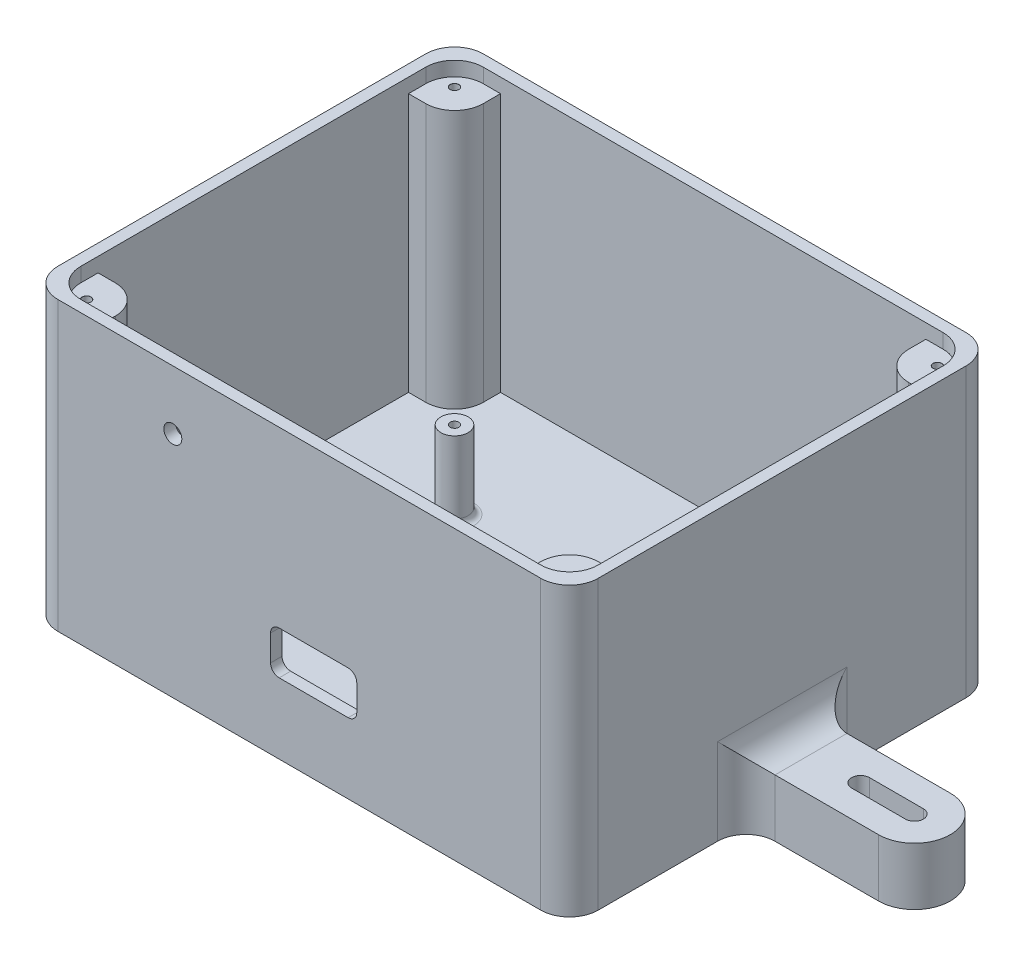
from build123d import *

# Parameters (mm, degrees)
ESBO_O1_W                                  = 4.75
ESBO_O1_H                                  = 1
REVOLU_O1_ANGLE                            = 180
ESBO_O2_W                                  = 9.5
ESBO_O2_H                                  = 74
RESSALTO_EXTRUS_O1_DEPTH                   = 8.75
ESBO_O3_W                                  = 8.75
ESBO_O3_H                                  = 73
CORTE_EXTRUS_O1_DEPTH                      = 1.5
ESBO_O4_W                                  = 8
ESBO_O4_H                                  = 73
CORTE_EXTRUS_O2_DEPTH                      = 4.75
ESBO_O5_W                                  = 4
ESBO_O5_H                                  = 68
RESSALTO_EXTRUS_O2_DEPTH                   = 52
ESBO_O6_W                                  = 4
ESBO_O6_H                                  = 74
RESSALTO_EXTRUS_O3_DEPTH                   = 80
ESBO_O7_W                                  = 4
ESBO_O7_H                                  = 74
RESSALTO_EXTRUS_O4_DEPTH                   = 40
ESBO_O8_W                                  = 144
ESBO_O8_H                                  = 74
RESSALTO_EXTRUS_O5_DEPTH                   = 4
ESBO_O9_W                                  = 144
ESBO_O9_H                                  = 74
RESSALTO_EXTRUS_O6_DEPTH                   = 4
ESBO_O10_W                                 = 188
ESBO_O10_H                                 = 74
RESSALTO_EXTRUS_O7_DEPTH                   = 4
ESBO_O11_W                                 = 188
ESBO_O11_H                                 = 148
RESSALTO_EXTRUS_O8_DEPTH                   = 26
CORTE_EXTRUS_O3_DEPTH                      = 21
RESSALTO_EXTRUS_O9_DEPTH                   = 20
CORTE_EXTRUS_O4_DEPTH                      = 268.847437919
RESSALTO_EXTRUS_O10_DEPTH                  = 20
CORTE_EXTRUS_O5_DEPTH                      = 262.040705638
ESBO_O17_W                                 = 16
ESBO_O17_H                                 = 16
RESSALTO_EXTRUS_O11_DEPTH                  = 90
ESBO_O18_W                                 = 16
ESBO_O18_H                                 = 16
RESSALTO_EXTRUS_O12_DEPTH                  = 90
ESBO_O19_W                                 = 16
ESBO_O19_H                                 = 16
RESSALTO_EXTRUS_O13_DEPTH                  = 90
ESBO_O20_W                                 = 16
ESBO_O20_H                                 = 16
RESSALTO_EXTRUS_O14_DEPTH                  = 90
RESSALTO_EXTRUS_O15_DEPTH                  = 22
ESBO_O22_W                                 = 4.75
ESBO_O22_H                                 = 22
FURO_DE_DI_METRO_3_0_3_1_D                 = 3
FURO_DE_DI_METRO_3_0_3_1_DEPTH             = 15
FURO_DE_DI_METRO_3_0_3_1_TIP               = 0.901290929
FURO_DE_DI_METRO_3_0_3_2_D                 = 3
FURO_DE_DI_METRO_3_0_3_2_DEPTH             = 15
FURO_DE_DI_METRO_3_0_3_2_TIP               = 0.901290929
BROCA_DE_ROSQUEAR_PARA_HELICOIDE_M61_D     = 6.25
BROCA_DE_ROSQUEAR_PARA_HELICOIDE_M61_DEPTH = 4
CHANFRO1_SIZE                              = 0.025
FILETE1_R                                  = 2
FILETE2_R                                  = 10
ESBO_O35_W                                 = 4.75
ESBO_O35_H                                 = 22
FILETE3_R                                  = 2
ESBO_O43_W                                 = 52
ESBO_O43_H                                 = 6
RESSALTO_EXTRUS_O16_DEPTH                  = 4
ESBO_O44_R                                 = 4.75
ESBO_O44_R_2                               = 1.525
RESSALTO_EXTRUS_O17_DEPTH                  = 5
CORTE_EXTRUS_O7_DEPTH                      = 10


with BuildPart() as part:
    # Esboço1 → Revolução1 (revolve)
    with BuildSketch(Plane.XY.offset(-4.75)):
        with Locations((97.625, 26.5)):
            Rectangle(ESBO_O1_W, ESBO_O1_H)
    revolve(axis=Axis((95.25, 27, -4.75), (0, 1, 0)), revolution_arc=REVOLU_O1_ANGLE)

    # Esboço2 → Ressalto-extrusão1 (add)
    with BuildSketch(Plane.XY.offset(-4.75)):
        with Locations((95.25, 63)):
            Rectangle(ESBO_O2_W, ESBO_O2_H)
    extrude(amount=RESSALTO_EXTRUS_O1_DEPTH)

    # Esboço3 → Corte-extrusão1 (cut)
    with BuildSketch(Plane.ZY.offset(-90.5)):
        with Locations((-0.375, 63.5)):
            Rectangle(ESBO_O3_W, ESBO_O3_H)
    extrude(amount=-CORTE_EXTRUS_O1_DEPTH, mode=Mode.SUBTRACT)

    # Esboço4 → Corte-extrusão2 (cut)
    with BuildSketch(Plane(origin=(0, 0, -4.75), x_dir=(-1, 0, 0), z_dir=(0, 0, -1))):
        with Locations((-96, 63.5)):
            Rectangle(ESBO_O4_W, ESBO_O4_H)
    extrude(amount=-CORTE_EXTRUS_O2_DEPTH, mode=Mode.SUBTRACT)

    # Esboço5 → Ressalto-extrusão2 (add)
    with BuildSketch(Plane.ZY.offset(-92)):
        with Locations((2, 66)):
            Rectangle(ESBO_O5_W, ESBO_O5_H)
    extrude(amount=RESSALTO_EXTRUS_O2_DEPTH)

    # Esboço6 → Ressalto-extrusão3 (add)
    with BuildSketch(Plane.ZY.offset(-40)):
        with Locations((2, 63)):
            Rectangle(ESBO_O6_W, ESBO_O6_H)
    extrude(amount=RESSALTO_EXTRUS_O3_DEPTH)

    # Esboço7 → Ressalto-extrusão4 (add)
    with BuildSketch(Plane(origin=(100, 0, 0), x_dir=(0, 0, -1), z_dir=(1, 0, 0))):
        with Locations((-2, 63)):
            Rectangle(ESBO_O7_W, ESBO_O7_H)
    extrude(amount=RESSALTO_EXTRUS_O4_DEPTH)

    # Esboço8 → Ressalto-extrusão5 (add)
    with BuildSketch(Plane(origin=(140, 0, 0), x_dir=(0, 0, -1), z_dir=(1, 0, 0))):
        with Locations((68, 63)):
            Rectangle(ESBO_O8_W, ESBO_O8_H)
    extrude(amount=RESSALTO_EXTRUS_O5_DEPTH)

    # Esboço9 → Ressalto-extrusão6 (add)
    with BuildSketch(Plane.ZY.offset(40)):
        with Locations((-68, 63)):
            Rectangle(ESBO_O9_W, ESBO_O9_H)
    extrude(amount=RESSALTO_EXTRUS_O6_DEPTH)

    # Esboço10 → Ressalto-extrusão7 (add)
    with BuildSketch(Plane(origin=(0, 0, -140), x_dir=(-1, 0, 0), z_dir=(0, 0, -1))):
        with Locations((-50, 63)):
            Rectangle(ESBO_O10_W, ESBO_O10_H)
    extrude(amount=RESSALTO_EXTRUS_O7_DEPTH)

    # Esboço11 → Ressalto-extrusão8 (add)
    with BuildSketch(Plane.XZ.offset(-26)):
        with Locations((50, -70)):
            Rectangle(ESBO_O11_W, ESBO_O11_H)
    extrude(amount=RESSALTO_EXTRUS_O8_DEPTH)

    # Esboço12 → Corte-extrusão3 (cut)
    with BuildSketch(Plane(origin=(0, 26, 0), x_dir=(-1, 0, 0), z_dir=(0, 1, 0))):
        with BuildLine():
            Line((-140, -140), (40, -140))
            Line((40, -140), (40, 0))
            Line((40, 0), (-90.5, 0))
            Line((-90.5, 0), (-90.5, -4.75))
            ThreePointArc((-90.5, -4.75), (-95.25, -9.5), (-100, -4.75))
            Line((-100, -4.75), (-100, 0))
            Line((-100, 0), (-140, 0))
            Line((-140, 0), (-140, -140))
        make_face()
    extrude(amount=-CORTE_EXTRUS_O3_DEPTH, mode=Mode.SUBTRACT)

    # Esboço13 → Ressalto-extrusão9 (add)
    with BuildSketch(Plane.XZ):
        with BuildLine():
            Line((144, -82.5), (190, -82.5))
            ThreePointArc((190, -82.5), (202.5, -70), (190, -57.5))
            Line((190, -57.5), (144, -57.5))
            Line((144, -57.5), (144, -82.5))
        make_face()
    extrude(amount=-RESSALTO_EXTRUS_O9_DEPTH)

    # Esboço14 → Corte-extrusão4 (cut, through all)
    with BuildSketch(Plane.XZ):
        with BuildLine():
            Line((190, -66.875), (171.25, -66.875))
            ThreePointArc((171.25, -66.875), (168.125, -70), (171.25, -73.125))
            Line((171.25, -73.125), (190, -73.125))
            ThreePointArc((190, -73.125), (193.125, -70), (190, -66.875))
        make_face()
    extrude(amount=-CORTE_EXTRUS_O4_DEPTH, mode=Mode.SUBTRACT)

    # Esboço15 → Ressalto-extrusão10 (add)
    with BuildSketch(Plane.XZ):
        with BuildLine():
            Line((-44, -57.5), (-90, -57.5))
            ThreePointArc((-90, -57.5), (-102.5, -70), (-90, -82.5))
            Line((-90, -82.5), (-44, -82.5))
            Line((-44, -82.5), (-44, -57.5))
        make_face()
    extrude(amount=-RESSALTO_EXTRUS_O10_DEPTH)

    # Esboço16 → Corte-extrusão5 (cut, through all)
    with BuildSketch(Plane(origin=(0, 20, 0), x_dir=(-1, 0, 0), z_dir=(0, 1, 0))):
        with BuildLine():
            Line((71.25, -73.125), (90, -73.125))
            ThreePointArc((90, -73.125), (93.125, -70), (90, -66.875))
            Line((90, -66.875), (71.25, -66.875))
            ThreePointArc((71.25, -66.875), (68.125, -70), (71.25, -73.125))
        make_face()
    extrude(amount=-CORTE_EXTRUS_O5_DEPTH, mode=Mode.SUBTRACT)

    # Esboço17 → Ressalto-extrusão11 (add)
    with BuildSketch(Plane(origin=(0, 5, 0), x_dir=(-1, 0, 0), z_dir=(0, 1, 0))):
        with Locations((32, -132)):
            Rectangle(ESBO_O17_W, ESBO_O17_H)
    extrude(amount=RESSALTO_EXTRUS_O11_DEPTH)

    # Esboço18 → Ressalto-extrusão12 (add)
    with BuildSketch(Plane(origin=(0, 5, 0), x_dir=(-1, 0, 0), z_dir=(0, 1, 0))):
        with Locations((-132, -132)):
            Rectangle(ESBO_O18_W, ESBO_O18_H)
    extrude(amount=RESSALTO_EXTRUS_O12_DEPTH)

    # Esboço19 → Ressalto-extrusão13 (add)
    with BuildSketch(Plane(origin=(0, 5, 0), x_dir=(-1, 0, 0), z_dir=(0, 1, 0))):
        with Locations((-132, -8)):
            Rectangle(ESBO_O19_W, ESBO_O19_H)
    extrude(amount=RESSALTO_EXTRUS_O13_DEPTH)

    # Esboço20 → Ressalto-extrusão14 (add)
    with BuildSketch(Plane(origin=(0, 5, 0), x_dir=(-1, 0, 0), z_dir=(0, 1, 0))):
        with Locations((32, -8)):
            Rectangle(ESBO_O20_W, ESBO_O20_H)
    extrude(amount=RESSALTO_EXTRUS_O14_DEPTH)

    # Esboço21 → Ressalto-extrusão15 (add)
    with BuildSketch(Plane(origin=(0, 5, 0), x_dir=(-1, 0, 0), z_dir=(0, 1, 0))):
        with BuildLine():
            Line((-9.5, -4.75), (-9.5, 0))
            Line((-9.5, 0), (0, 0))
            Line((0, 0), (0, -4.75))
            ThreePointArc((0, -4.75), (-4.75, -9.5), (-9.5, -4.75))
        make_face()
    extrude(amount=RESSALTO_EXTRUS_O15_DEPTH)

    # Esboço22 → Revolução2 (revolve)
    with BuildSketch(Plane.XY.offset(-95.25)):
        with Locations((7.125, 16)):
            Rectangle(ESBO_O22_W, ESBO_O22_H)
    revolve(axis=Axis((4.75, 27, -95.25), (0, -1, 0)))

    # Furo de diâmetro Ø3.0 (3)1
    with Locations(Plane(origin=(0, 95, 0), x_dir=(1, 0, 0), z_dir=(0, 1, 0))):
        with Locations((-34, 6), (134, 6), (134, 134), (-34, 134)):
            Hole(FURO_DE_DI_METRO_3_0_3_1_D / 2, depth=FURO_DE_DI_METRO_3_0_3_1_DEPTH)
            with Locations((0, 0, -(FURO_DE_DI_METRO_3_0_3_1_DEPTH + FURO_DE_DI_METRO_3_0_3_1_TIP / 2))):  # 118° drill point
                Cone(0, FURO_DE_DI_METRO_3_0_3_1_D / 2, FURO_DE_DI_METRO_3_0_3_1_TIP, mode=Mode.SUBTRACT)

    # Furo de diâmetro Ø3.0 (3)2
    with Locations(Plane(origin=(0, 27, 0), x_dir=(1, 0, 0), z_dir=(0, 1, 0))):
        with Locations((95.25, 4.75), (4.75, 4.75), (4.75, 95.25)):
            Hole(FURO_DE_DI_METRO_3_0_3_2_D / 2, depth=FURO_DE_DI_METRO_3_0_3_2_DEPTH)
            with Locations((0, 0, -(FURO_DE_DI_METRO_3_0_3_2_DEPTH + FURO_DE_DI_METRO_3_0_3_2_TIP / 2))):  # 118° drill point
                Cone(0, FURO_DE_DI_METRO_3_0_3_2_D / 2, FURO_DE_DI_METRO_3_0_3_2_TIP, mode=Mode.SUBTRACT)

    # Broca de rosquear para helicoide M61
    with Locations(Plane.XY.offset(4)):
        with Locations((6, 79.5)):
            Hole(BROCA_DE_ROSQUEAR_PARA_HELICOIDE_M61_D / 2, depth=BROCA_DE_ROSQUEAR_PARA_HELICOIDE_M61_DEPTH)

    # Chanfro1
    chanfro1_edges = [part.edges().sort_by_distance(p)[0] for p in [
        (96.75, 27, -4.75),
        (6.25, 27, -95.25),
        (135.5, 95, -6),
        (-32.5, 95, -6),
        (6.25, 27, -4.75),
        (135.5, 95, -134),
        (-32.5, 95, -134),
    ]]
    chamfer(chanfro1_edges, length=CHANFRO1_SIZE)

    # Filete1
    filete1_edges = [part.edges().sort_by_distance(p)[0] for p in [
        (92, 32, 2),
        (40, 26, 2),
        (40, 32, 2),
    ]]
    fillet(filete1_edges, radius=FILETE1_R)

    # Filete2
    filete2_edges = [part.edges().sort_by_distance(p)[0] for p in [
        (124, 50, -124),
        (-44, 10, -82.5),
        (-44, 20, -70),
        (-44, 10, -57.5),
        (144, 10, -82.5),
        (144, 10, -57.5),
        (144, 20, -70),
        (140, 97.5, -140),
        (140, 97.5, 0),
        (-24, 50, -16),
        (-40, 97.5, 0),
        (-40, 97.5, -140),
        (144, 50, -144),
        (-24, 50, -124),
        (-44, 50, -144),
        (124, 50, -16),
        (-44, 50, 4),
        (144, 50, 4),
    ]]
    fillet(filete2_edges, radius=FILETE2_R)

    # Esboço35 → Revolução3 (revolve)
    with BuildSketch(Plane.XY.offset(-95.25)):
        with Locations((97.625, 16)):
            Rectangle(ESBO_O35_W, ESBO_O35_H)
    revolve(axis=Axis((95.25, 27, -95.25), (0, -1, 0)))

    # Esboço42 → Corte-Revolução1 (revolve, cut)
    with BuildSketch(Plane.XY.offset(-95.25)):
        Polygon((96.775, 27), (95.25, 27), (95.25, 11.098709071), (96.75, 12), (96.75, 26.975), align=None)
    revolve(axis=Axis((95.25, 27, -95.25), (0, -1, 0)), mode=Mode.SUBTRACT)

    # Filete3
    filete3_edges = [part.edges().sort_by_distance(p)[0] for p in [
        (0, 5, -2.375),
        (9.5, 5, -2.375),
        (4.75, 5, -9.5),
        (100, 5, -2.375),
        (95.25, 5, -9.5),
        (90.5, 5, -2.375),
        (90.5, 5, -95.25),
        (0, 5, -95.25),
    ]]
    fillet(filete3_edges, radius=FILETE3_R)

    # Esboço43 → Ressalto-extrusão16 (add)
    with BuildSketch(Plane.XY.offset(4)):
        with Locations((66, 29)):
            Rectangle(ESBO_O43_W, ESBO_O43_H)
    extrude(amount=-RESSALTO_EXTRUS_O16_DEPTH)

    # Esboço44 → Ressalto-extrusão17 (add, symmetric)
    # profile 1 of 4: a face of its own
    with BuildSketch(Plane(origin=(0, 27, 0), x_dir=(-1, 0, 0), z_dir=(0, 1, 0))):
        with Locations((-4.75, -95.25)):
            Circle(ESBO_O44_R)
        with Locations((-4.75, -95.25)):
            Circle(ESBO_O44_R_2, mode=Mode.SUBTRACT)
    # profile 2 of 4: a face of its own
    with BuildSketch(Plane(origin=(0, 27, 0), x_dir=(-1, 0, 0), z_dir=(0, 1, 0))):
        with Locations((-95.25, -95.25)):
            Circle(ESBO_O44_R)
        with Locations((-95.25, -95.25)):
            Circle(ESBO_O44_R_2, mode=Mode.SUBTRACT)
    # profile 3 of 4: a face of its own
    with BuildSketch(Plane(origin=(0, 27, 0), x_dir=(-1, 0, 0), z_dir=(0, 1, 0))):
        with BuildLine():
            Line((-9.5, -4.75), (-9.5, 0))
            Line((-9.5, 0), (0, 0))
            Line((0, 0), (0, -4.75))
            ThreePointArc((0, -4.75), (-4.75, -9.5), (-9.5, -4.75))
        make_face()
        with Locations((-4.75, -4.75)):
            Circle(ESBO_O44_R_2, mode=Mode.SUBTRACT)
    # profile 4 of 4: a face of its own
    with BuildSketch(Plane(origin=(0, 27, 0), x_dir=(-1, 0, 0), z_dir=(0, 1, 0))):
        with BuildLine():
            Line((-100, 0), (-100, -4.75))
            ThreePointArc((-100, -4.75), (-95.25, -9.5), (-90.5, -4.75))
            Line((-90.5, -4.75), (-90.5, 0))
            Line((-90.5, 0), (-100, 0))
        make_face()
        with Locations((-95.25, -4.75)):
            Circle(ESBO_O44_R_2, mode=Mode.SUBTRACT)
    extrude(amount=RESSALTO_EXTRUS_O17_DEPTH, both=True)

    # Esboço47 → Corte-extrusão7 (cut)
    with BuildSketch(Plane.XY.offset(4)):
        with BuildLine():
            Line((43, 39.5), (67, 39.5))
            ThreePointArc((67, 39.5), (69.121320344, 38.621320344), (70, 36.5))
            Line((70, 36.5), (70, 27.5))
            ThreePointArc((70, 27.5), (69.121320344, 25.378679656), (67, 24.5))
            Line((67, 24.5), (43, 24.5))
            ThreePointArc((43, 24.5), (40.878679656, 25.378679656), (40, 27.5))
            Line((40, 27.5), (40, 36.5))
            ThreePointArc((40, 36.5), (40.878679656, 38.621320344), (43, 39.5))
        make_face()
    extrude(amount=-CORTE_EXTRUS_O7_DEPTH, mode=Mode.SUBTRACT)


solid = part.part
